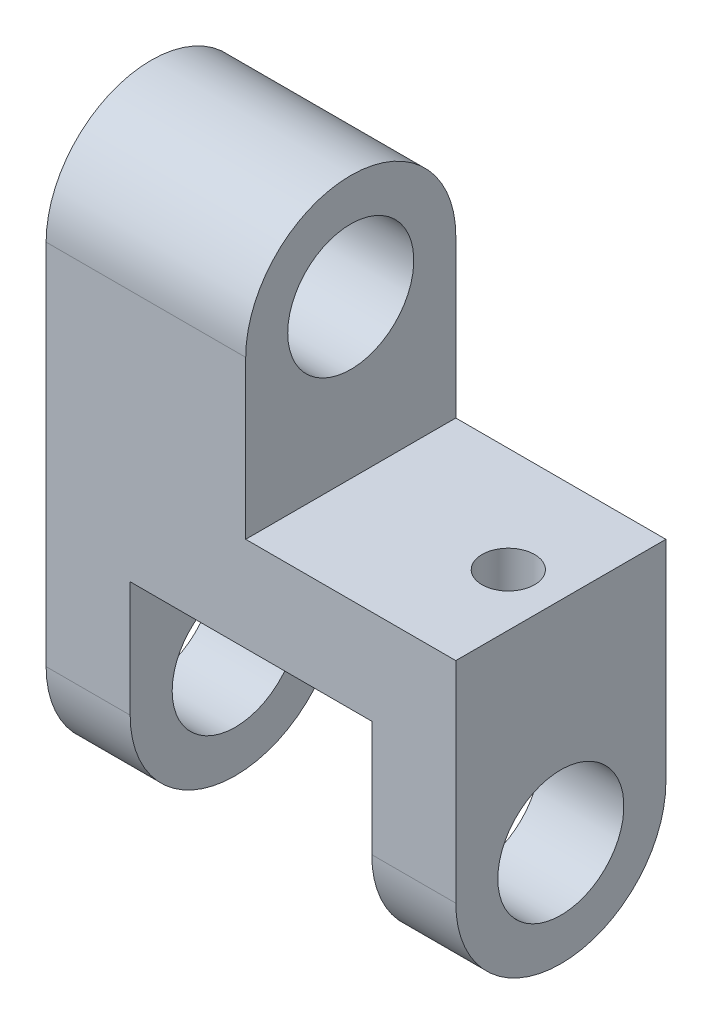
from build123d import *

# Parameters (mm, degrees)
SKETCH_1_R               = 6
EXTRUDE_1_DEPTH          = 39
CUT_EXTRUDE_1_DEPTH      = 49.757050772
CUT_EXTRUDE_1_DEPTH_BACK = 49.757050772
SKETCH_2_W               = 23
SKETCH_2_H               = 34.092407746
CUT_EXTRUDE_2_DEPTH      = 49.757050772
CUT_EXTRUDE_2_DEPTH_BACK = 49.757050772
SKETCH_3_W               = 43.713213687
SKETCH_3_H               = 32.597275916
SKETCH_4_R               = 2.5
CUT_EXTRUDE_3_DEPTH      = 12


with BuildPart() as part:
    # Эскиз1 → Бобышка-Вытянуть1 (new body)
    with BuildSketch(Plane(origin=(0, 0, 0), x_dir=(0, 0, -1), z_dir=(1, 0, 0))):
        with BuildLine():
            Line((10, 17.5), (10, -17.5))
            ThreePointArc((10, -17.5), (0, -27.5), (-10, -17.5))
            Line((-10, -17.5), (-10, 17.5))
            ThreePointArc((-10, 17.5), (0, 27.5), (10, 17.5))
        make_face()
        with Locations((0, 17.5)):
            Circle(SKETCH_1_R, mode=Mode.SUBTRACT)
        with Locations((0, -17.5)):
            Circle(SKETCH_1_R, mode=Mode.SUBTRACT)
    extrude(amount=EXTRUDE_1_DEPTH)

    # Эскиз2 → Вырез-Вытянуть1 (cut, two sides: drawn at the far end of the back side and taken through both)
    with BuildSketch(Plane.XY.offset(-CUT_EXTRUDE_1_DEPTH_BACK)):
        with Locations((19.5, -23.546203873)):
            Rectangle(SKETCH_2_W, SKETCH_2_H)
    extrude(amount=CUT_EXTRUDE_1_DEPTH + CUT_EXTRUDE_1_DEPTH_BACK, mode=Mode.SUBTRACT)

    # Эскиз3 → Вырез-Вытянуть2 (cut, two sides: drawn at the far end of the back side and taken through both)
    with BuildSketch(Plane.XY.offset(-CUT_EXTRUDE_2_DEPTH_BACK)):
        with Locations((40.856606844, 18.798637958)):
            Rectangle(SKETCH_3_W, SKETCH_3_H)
    extrude(amount=CUT_EXTRUDE_2_DEPTH + CUT_EXTRUDE_2_DEPTH_BACK, mode=Mode.SUBTRACT)

    # Эскиз4 → Вырез-Вытянуть3 (cut)
    with BuildSketch(Plane(origin=(0, 2.5, 0), x_dir=(1, 0, 0), z_dir=(0, 1, 0))):
        with Locations((34, 0)):
            Circle(SKETCH_4_R)
    extrude(amount=-CUT_EXTRUDE_3_DEPTH, mode=Mode.SUBTRACT)


solid = part.part
